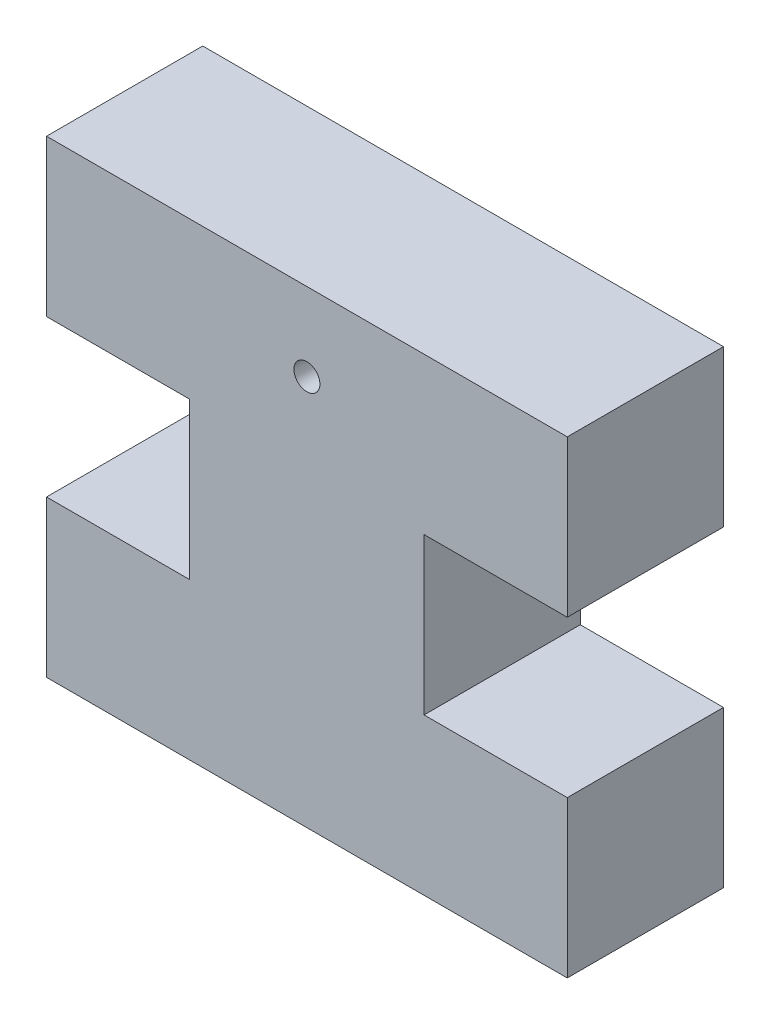
from build123d import *

# Parameters (mm, degrees)
SKETCH1_R           = 0.5
BOSS_EXTRUDE1_DEPTH = 6
SKETCH2_W           = 20
SKETCH2_H           = 6
BOSS_EXTRUDE2_DEPTH = 6


with BuildPart() as part:
    # Sketch1 → Boss-Extrude1 (new body)
    with BuildSketch(Plane.XY):
        Polygon((0, 0), (9, 0), (9, 6), (14.5, 6), (14.5, 12), (-5.5, 12), (-5.5, 6), (0, 6), align=None)
        with Locations((4.5, 9)):
            Circle(SKETCH1_R, mode=Mode.SUBTRACT)
    extrude(amount=BOSS_EXTRUDE1_DEPTH)

    # Sketch2 → Boss-Extrude2 (add)
    with BuildSketch(Plane.XZ):
        with Locations((4.5, 3)):
            Rectangle(SKETCH2_W, SKETCH2_H)
    extrude(amount=BOSS_EXTRUDE2_DEPTH)


solid = part.part
